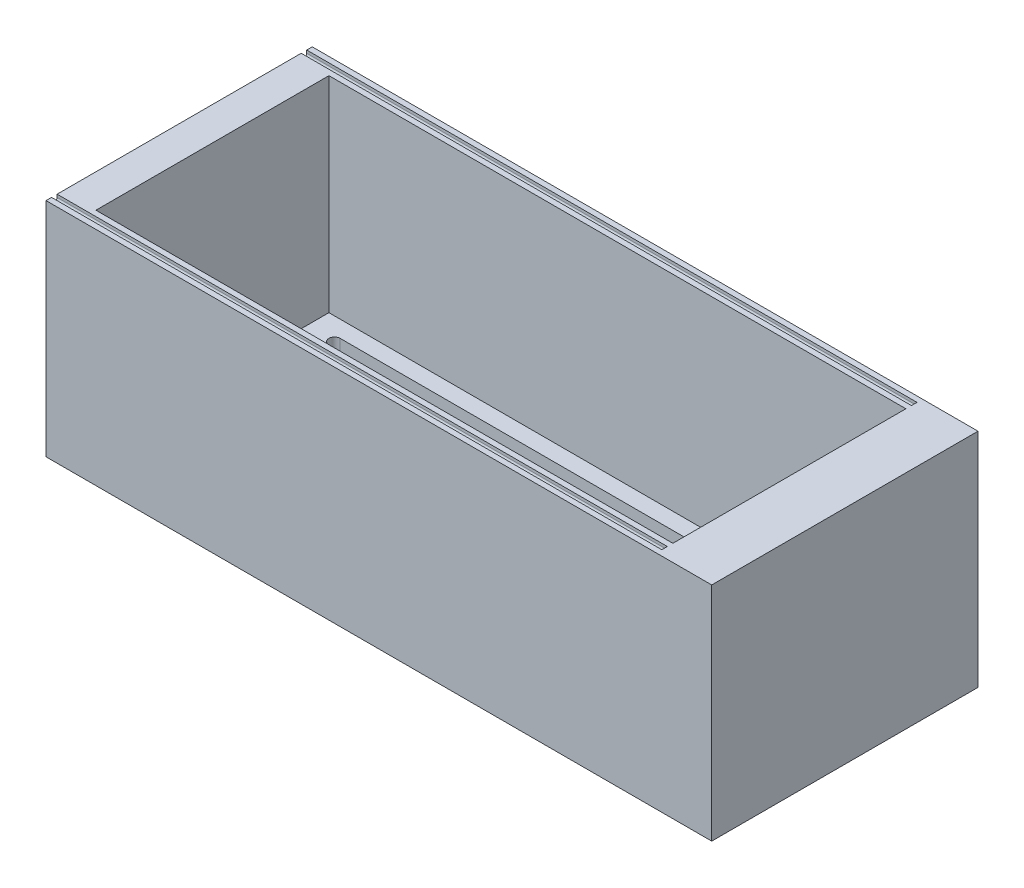
from build123d import *

# Parameters (mm, degrees)
SKETCH1_W           = 120
SKETCH1_H           = 48
BOSS_EXTRUDE1_DEPTH = 40
SKETCH3_W           = 104
SKETCH3_H           = 42
CUT_EXTRUDE1_DEPTH  = 37
CUT_EXTRUDE2_DEPTH  = 37
CUT_EXTRUDE4_DEPTH  = 110
CUT_EXTRUDE5_DEPTH  = 110


with BuildPart() as part:
    # Sketch1 → Boss-Extrude1 (new body)
    with BuildSketch(Plane(origin=(0, 0, 0), x_dir=(1, 0, 0), z_dir=(0, 1, 0))):
        with Locations((60, 24)):
            Rectangle(SKETCH1_W, SKETCH1_H)
    extrude(amount=BOSS_EXTRUDE1_DEPTH)

    # Sketch3 → Cut-Extrude1 (cut)
    with BuildSketch(Plane(origin=(0, 40, 0), x_dir=(1, 0, 0), z_dir=(0, 1, 0))):
        with Locations((58, 24)):
            Rectangle(SKETCH3_W, SKETCH3_H)
    extrude(amount=-CUT_EXTRUDE1_DEPTH, mode=Mode.SUBTRACT)

    # Sketch5 → Cut-Extrude2 (cut)
    with BuildSketch(Plane(origin=(0, 3, 0), x_dir=(1, 0, 0), z_dir=(0, 1, 0))):
        with BuildLine():
            Line((11, 42), (105, 42))
            ThreePointArc((105, 42), (106, 41), (105, 40))
            Line((105, 40), (11, 40))
            ThreePointArc((11, 40), (10, 41), (11, 42))
        make_face()
        with BuildLine():
            Line((11, 35.1), (105, 35.1))
            ThreePointArc((105, 35.1), (106, 36.1), (105, 37.1))
            Line((105, 37.1), (11, 37.1))
            ThreePointArc((11, 37.1), (10, 36.1), (11, 35.1))
        make_face()
        with BuildLine():
            Line((11, 30.2), (105, 30.2))
            ThreePointArc((105, 30.2), (106, 31.2), (105, 32.2))
            Line((105, 32.2), (11, 32.2))
            ThreePointArc((11, 32.2), (10, 31.2), (11, 30.2))
        make_face()
        with BuildLine():
            Line((11, 25.3), (105, 25.3))
            ThreePointArc((105, 25.3), (106, 26.3), (105, 27.3))
            Line((105, 27.3), (11, 27.3))
            ThreePointArc((11, 27.3), (10, 26.3), (11, 25.3))
        make_face()
        with BuildLine():
            Line((11, 20.4), (105, 20.4))
            ThreePointArc((105, 20.4), (106, 21.4), (105, 22.4))
            Line((105, 22.4), (11, 22.4))
            ThreePointArc((11, 22.4), (10, 21.4), (11, 20.4))
        make_face()
        with BuildLine():
            Line((11, 15.5), (105, 15.5))
            ThreePointArc((105, 15.5), (106, 16.5), (105, 17.5))
            Line((105, 17.5), (11, 17.5))
            ThreePointArc((11, 17.5), (10, 16.5), (11, 15.5))
        make_face()
        with BuildLine():
            Line((11, 10.6), (105, 10.6))
            ThreePointArc((105, 10.6), (106, 11.6), (105, 12.6))
            Line((105, 12.6), (11, 12.6))
            ThreePointArc((11, 12.6), (10, 11.6), (11, 10.6))
        make_face()
        with BuildLine():
            Line((11, 5.7), (105, 5.7))
            ThreePointArc((105, 5.7), (106, 6.7), (105, 7.7))
            Line((105, 7.7), (11, 7.7))
            ThreePointArc((11, 7.7), (10, 6.7), (11, 5.7))
        make_face()
    extrude(amount=-CUT_EXTRUDE2_DEPTH, mode=Mode.SUBTRACT)

    # Sketch7 → Cut-Extrude4 (cut)
    with BuildSketch(Plane.ZY):
        with BuildLine():
            Line((-2, 39.5), (-2, 40.5))
            ThreePointArc((-2, 40.5), (-1.5, 41), (-1, 40.5))
            Line((-1, 40.5), (-1, 39.5))
            ThreePointArc((-1, 39.5), (-1.5, 39), (-2, 39.5))
        make_face()
    cut_extrude4 = extrude(amount=-CUT_EXTRUDE4_DEPTH, mode=Mode.SUBTRACT)

    # Mirror1: Cut-Extrude4 across plane
    add(cut_extrude4.mirror(Plane(origin=(0, 0, -24), x_dir=(1, 0, 0), z_dir=(0, 0, -1))), mode=Mode.SUBTRACT)

    # Sketch8 → Cut-Extrude5 (cut)
    with BuildSketch(Plane.ZY):
        with BuildLine():
            Line((-48.5, 2), (-47.5, 2))
            ThreePointArc((-47.5, 2), (-47, 1.5), (-47.5, 1))
            Line((-47.5, 1), (-48.5, 1))
            ThreePointArc((-48.5, 1), (-49, 1.5), (-48.5, 2))
        make_face()
    extrude(amount=-CUT_EXTRUDE5_DEPTH, mode=Mode.SUBTRACT)


solid = part.part
